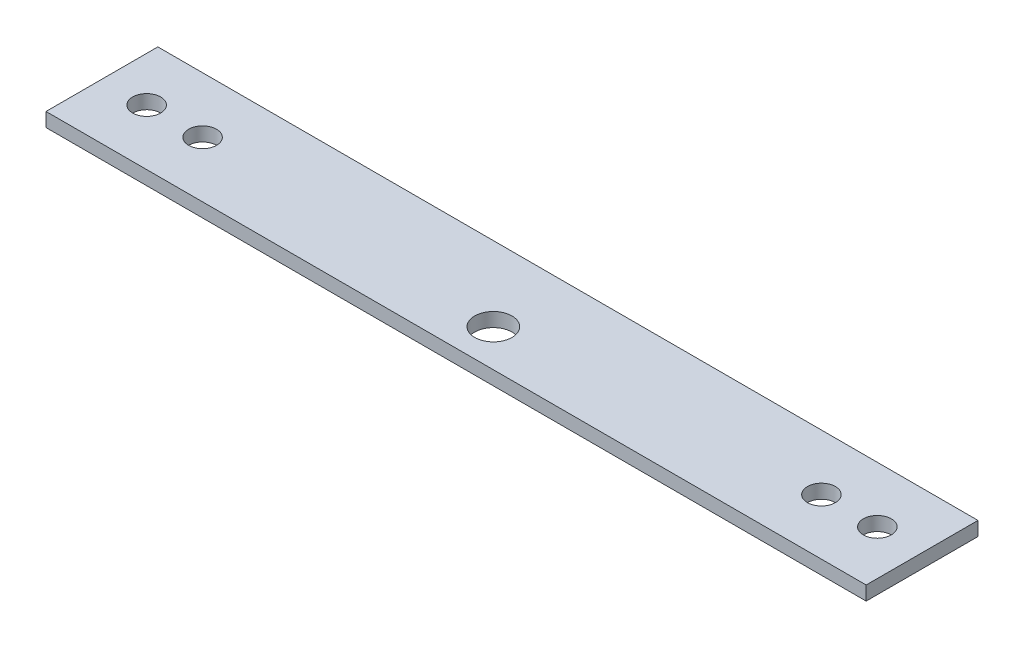
from build123d import *

# Parameters (mm, degrees)
SKETCH2_W           = 279.4
SKETCH2_H           = 38.1
SKETCH2_R           = 4.7625
SKETCH2_R_2         = 6.35
BOSS_EXTRUDE1_DEPTH = 4.7625


with BuildPart() as part:
    # Sketch2 → Boss-Extrude1 (new body)
    with BuildSketch(Plane(origin=(0, 0, 0), x_dir=(1, 0, 0), z_dir=(0, 1, 0))):
        Rectangle(SKETCH2_W, SKETCH2_H)
        with Locations((-124.46, 0)):
            Circle(SKETCH2_R, mode=Mode.SUBTRACT)
        with Locations((-105.41, 0)):
            Circle(SKETCH2_R, mode=Mode.SUBTRACT)
        with Locations((124.46, 0)):
            Circle(SKETCH2_R, mode=Mode.SUBTRACT)
        with Locations((105.41, 0)):
            Circle(SKETCH2_R, mode=Mode.SUBTRACT)
        with Locations((0, -6.35)):
            Circle(SKETCH2_R_2, mode=Mode.SUBTRACT)
    extrude(amount=BOSS_EXTRUDE1_DEPTH)


solid = part.part
